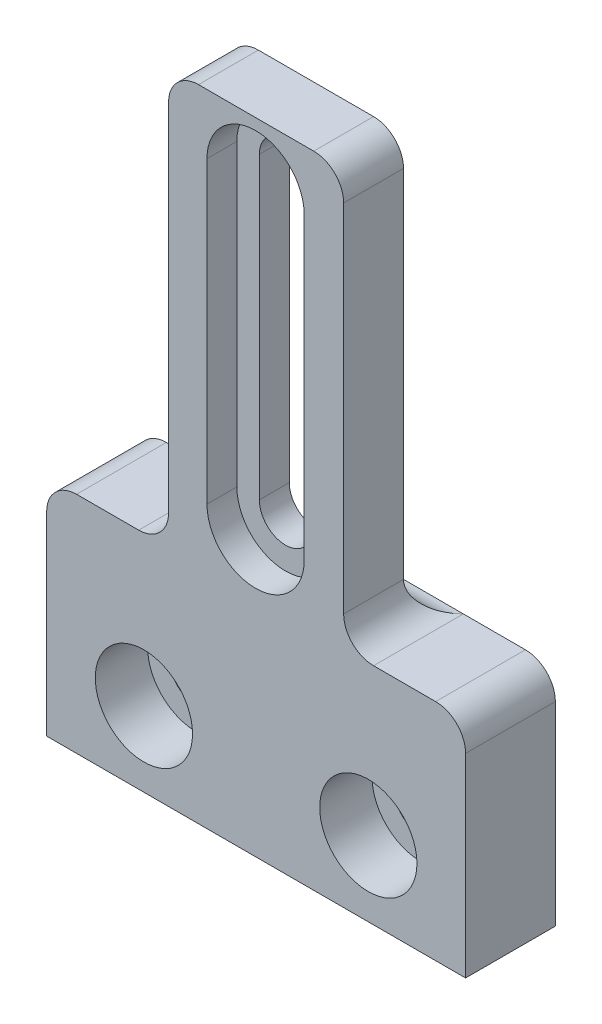
from build123d import *

# Parameters (mm, degrees)
BOSS_EXTRUDE1_DEPTH     = 6
CUT_EXTRUDE1_DEPTH      = 33.32645975048922
CUT_EXTRUDE1_DEPTH_BACK = 33.32645975048922
SKETCH3_R               = 1.7500000000000002
SKETCH3_R_2             = 1.7499999999999998
SKETCH6_R               = 3.2500000000000004
SKETCH6_R_2             = 3.25
CUT_EXTRUDE2_DEPTH      = 3.5
SKETCH7_W               = 11.699999999999998
SKETCH7_H               = 27.786688839798195
BOSS_EXTRUDE2_DEPTH     = 6
SKETCH8_W               = 11.699999999999998
SKETCH8_H               = 27.786688839798195
CUT_EXTRUDE3_DEPTH      = 2
FILLET1_R               = 2
FILLET2_R               = 2
FILLET3_R               = 2
CUT_EXTRUDE4_DEPTH      = 52.48495646180262
CUT_EXTRUDE4_DEPTH_BACK = 52.48495646180262
CUT_EXTRUDE5_DEPTH      = 52.48495646180262
CUT_EXTRUDE5_DEPTH_BACK = 2
FILLET4_R               = 2
FILLET5_R               = 2


with BuildPart() as part:
    # Sketch2 → Boss-Extrude1 (new body)
    with BuildSketch(Plane.XY):
        Polygon((-27.999999999999996, 15), (1.84e-15, 15), (0, 0), (-27.999999999999996, 0), align=None)
    extrude(amount=BOSS_EXTRUDE1_DEPTH)

    # Sketch3 → Cut-Extrude1 (cut, two sides: drawn at the far end of the back side and taken through both)
    with BuildSketch(Plane.XY.offset(6).offset(-CUT_EXTRUDE1_DEPTH_BACK)):
        with Locations((-21.5, 4.999999999999999)):
            Circle(SKETCH3_R)
        with Locations((-6.5, 4.999999999999999)):
            Circle(SKETCH3_R_2)
    extrude(amount=CUT_EXTRUDE1_DEPTH + CUT_EXTRUDE1_DEPTH_BACK, mode=Mode.SUBTRACT)

    # Sketch6 → Cut-Extrude2 (cut)
    with BuildSketch(Plane.XY.offset(6)):
        with Locations((-21.5, 4.999999999999999)):
            Circle(SKETCH6_R)
        with Locations((-6.500000000000001, 4.999999999999999)):
            Circle(SKETCH6_R_2)
    extrude(amount=-CUT_EXTRUDE2_DEPTH, mode=Mode.SUBTRACT)

    # Sketch7 → Boss-Extrude2 (add)
    with BuildSketch(Plane(origin=(0, 0, 0), x_dir=(-1, 0, 0), z_dir=(0, 0, -1))):
        with Locations((14, 28.893344419899098)):
            Rectangle(SKETCH7_W, SKETCH7_H)
    extrude(amount=-BOSS_EXTRUDE2_DEPTH)

    # Sketch8 → Cut-Extrude3 (cut)
    with BuildSketch(Plane(origin=(0, 0, 0), x_dir=(-1, 0, 0), z_dir=(0, 0, -1))):
        with Locations((14, 28.893344419899098)):
            Rectangle(SKETCH8_W, SKETCH8_H)
    extrude(amount=-CUT_EXTRUDE3_DEPTH, mode=Mode.SUBTRACT)

    # Fillet1
    fillet1_edges = [part.edges().sort_by_distance(p)[0] for p in [
        (-14, 15, 2),
    ]]
    fillet(fillet1_edges, radius=FILLET1_R - 0.0001)  # a hair under: the kernel refuses the full size

    # Fillet2
    fillet2_edges = [part.edges().sort_by_distance(p)[0] for p in [
        (-8.15, 15, 3.0000500000000003),
    ]]
    fillet(fillet2_edges, radius=FILLET2_R)

    # Fillet3
    fillet3_edges = [part.edges().sort_by_distance(p)[0] for p in [
        (-19.849999999999998, 15, 3.00005),
    ]]
    fillet(fillet3_edges, radius=FILLET3_R)

    # Sketch9 → Cut-Extrude4 (cut, two sides: drawn at the far end of the back side and taken through both)
    with BuildSketch(Plane.XY.offset(6).offset(-CUT_EXTRUDE4_DEPTH_BACK)):
        with BuildLine():
            Line((-12.28493666219322, 38.78668883979819), (-12.284936662193216, 18.786688839798188))
            ThreePointArc((-12.284936662193216, 18.786688839798188), (-14.034936662193216, 17.036688839798188), (-15.784936662193216, 18.786688839798188))
            Line((-15.784936662193216, 18.786688839798188), (-15.78493666219322, 38.78668883979819))
            ThreePointArc((-15.78493666219322, 38.78668883979819), (-14.03493666219322, 40.53668883979819), (-12.28493666219322, 38.78668883979819))
        make_face()
    extrude(amount=CUT_EXTRUDE4_DEPTH + CUT_EXTRUDE4_DEPTH_BACK, mode=Mode.SUBTRACT)

    # Sketch10 → Cut-Extrude5 (cut, two sides: drawn at the far end of the back side and taken through both)
    with BuildSketch(Plane.XY.offset(6).offset(-CUT_EXTRUDE5_DEPTH_BACK)):
        with BuildLine():
            Line((-10.784936662193223, 38.78668883979819), (-10.78493666219322, 18.786688839798188))
            ThreePointArc((-10.78493666219322, 18.786688839798188), (-14.034936662193216, 15.536688839798186), (-17.284936662193218, 18.786688839798188))
            Line((-17.284936662193218, 18.786688839798188), (-17.284936662193218, 38.78668883979819))
            ThreePointArc((-17.284936662193218, 38.78668883979819), (-14.03493666219322, 42.03668883979819), (-10.784936662193223, 38.78668883979819))
        make_face()
    extrude(amount=CUT_EXTRUDE5_DEPTH + CUT_EXTRUDE5_DEPTH_BACK, mode=Mode.SUBTRACT)

    # Fillet4
    fillet4_edges = [part.edges().sort_by_distance(p)[0] for p in [
        (-8.15, 42.786688839798195, 4),
        (-19.849999999999998, 42.786688839798195, 4),
    ]]
    fillet(fillet4_edges, radius=FILLET4_R)

    # Fillet5
    fillet5_edges = [part.edges().sort_by_distance(p)[0] for p in [
        (-27.999999999999996, 15, 3),
        (1.84e-15, 15, 3),
    ]]
    fillet(fillet5_edges, radius=FILLET5_R)


solid = part.part
